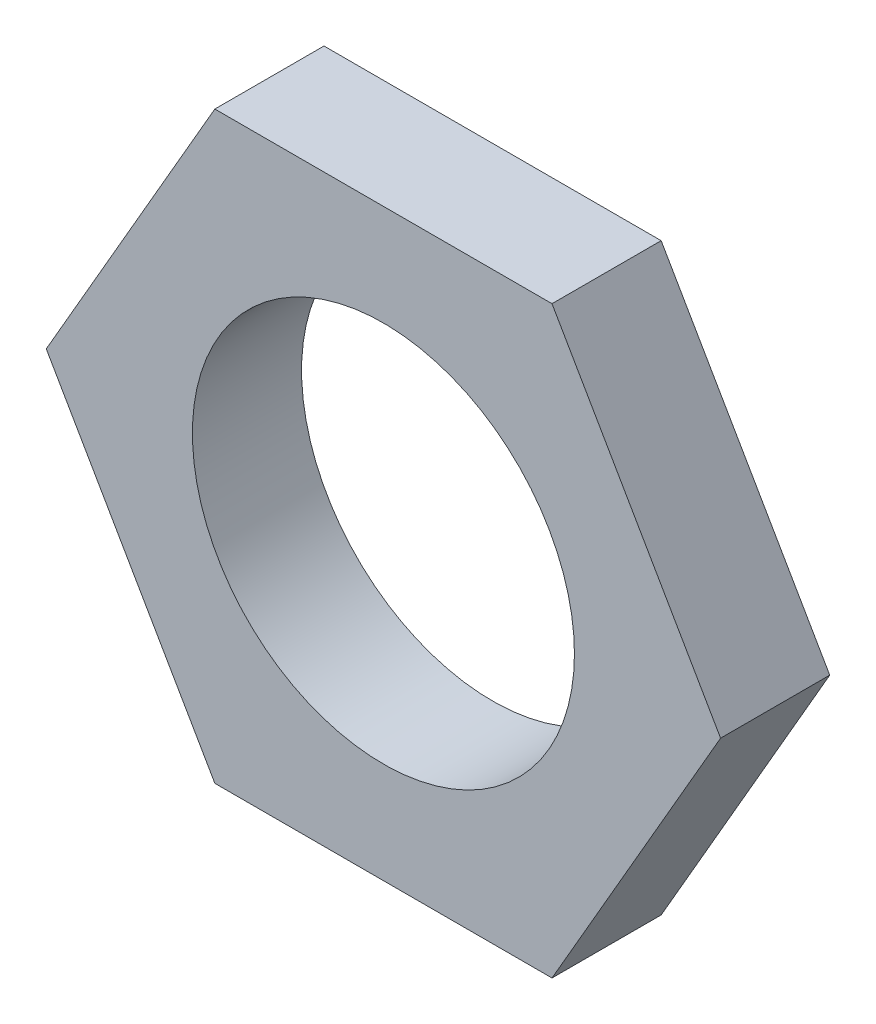
from build123d import *

# Parameters (mm, degrees)
BOSS_EXTRUDE1_DEPTH = 2
SKETCH2_R           = 3.5
CUT_EXTRUDE1_DEPTH  = 2


with BuildPart() as part:
    # Sketch1 → Boss-Extrude1 (new body)
    with BuildSketch(Plane.XY):
        Polygon((-6.17764788, 0), (-3.08882394, -5.35), (3.08882394, -5.35), (6.17764788, 0), (3.08882394, 5.35), (-3.08882394, 5.35), align=None)
    extrude(amount=BOSS_EXTRUDE1_DEPTH)

    # Sketch2 → Cut-Extrude1 (cut)
    with BuildSketch(Plane.XY.offset(2)):
        Circle(SKETCH2_R)
    extrude(amount=-CUT_EXTRUDE1_DEPTH, mode=Mode.SUBTRACT)


solid = part.part
